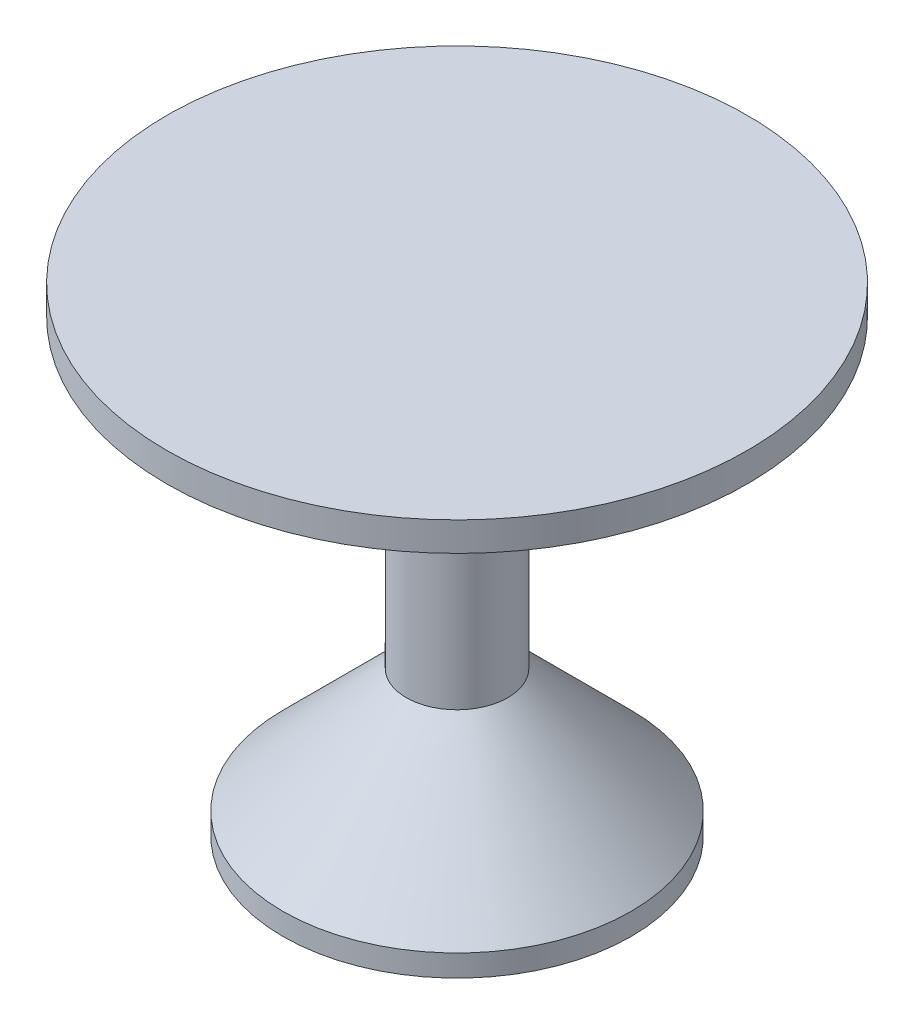
from build123d import *

# Parameters (mm, degrees)
SKETCH_1_R      = 24.5
EXTRUDE_1_DEPTH = 4
SKETCH_Q_R      = 60
EXTRUDE_2_DEPTH = 5
SKETCH_3_R      = 17.5
EXTRUDE_3_DEPTH = 150
SKETCH_4_R      = 100
EXTRUDE_4_DEPTH = 10
CHAMFER_1_SIZE  = 45
CHAMFER_2_SIZE  = 30
CHAMFER_2_SIZE2 = 51.961524227


with BuildPart() as part:
    # 草图1 → 凸台-拉伸1 (new body)
    with BuildSketch(Plane(origin=(0, 0, 0), x_dir=(1, 0, 0), z_dir=(0, 1, 0))):
        with Locations(Location((0, 0, 0), (0, 0, 270))):
            Circle(SKETCH_1_R)
    extrude(amount=EXTRUDE_1_DEPTH)

    # q → 凸台-拉伸2 (add)
    with BuildSketch(Plane(origin=(0, 4, 0), x_dir=(1, 0, 0), z_dir=(0, 1, 0))):
        with Locations(Location((0, 0, 0), (0, 0, 270))):
            Circle(SKETCH_Q_R)
    extrude(amount=EXTRUDE_2_DEPTH)

    # 草图3 → 凸台-拉伸3 (add)
    with BuildSketch(Plane(origin=(0, 9, 0), x_dir=(1, 0, 0), z_dir=(0, 1, 0))):
        with Locations(Location((0, 0, 0), (0, 0, 270))):
            Circle(SKETCH_3_R)
    extrude(amount=EXTRUDE_3_DEPTH)

    # 草图4 → 凸台-拉伸4 (add)
    with BuildSketch(Plane(origin=(0, 159, 0), x_dir=(1, 0, 0), z_dir=(0, 1, 0))):
        with Locations(Location((0, 0, 0), (0, 0, 270))):
            Circle(SKETCH_4_R)
    extrude(amount=EXTRUDE_4_DEPTH)

    # 倒角1
    # the kernel refuses this chamfer: 45 mm, written as the material it adds along each edge
    with BuildSketch(Plane(origin=(0, 9, 0), x_dir=(0, 0, 1), z_dir=(-1, 0, 0))) as chamfer_1_piece_1_section:
        Polygon((17.5, CHAMFER_1_SIZE), (17.5 + CHAMFER_1_SIZE, 0), (17.5, 0), align=None)
    chamfer_1_piece_1 = revolve(axis=Axis((0, 9, 0), (0, 1, 0)), mode=Mode.PRIVATE)
    chamfer_1_piece_1 = chamfer_1_piece_1 & Plane(origin=(0, 32.95787502, 0), x_dir=(0, 0, 1), z_dir=(0, -1, 0)) * Cylinder(60, 250, mode=Mode.PRIVATE)
    add(chamfer_1_piece_1)

    # 倒角2
    chamfer_2_edges = [part.edges().sort_by_distance(p)[0] for p in [
        (0, 159, -17.5),
    ]]
    chamfer_2_side = [part.faces().sort_by_distance(p)[0] for p in [
        (0, 106.5, -17.5),
    ]]
    chamfer(chamfer_2_edges, length=CHAMFER_2_SIZE, length2=CHAMFER_2_SIZE2, reference=chamfer_2_side[0])


solid = part.part
